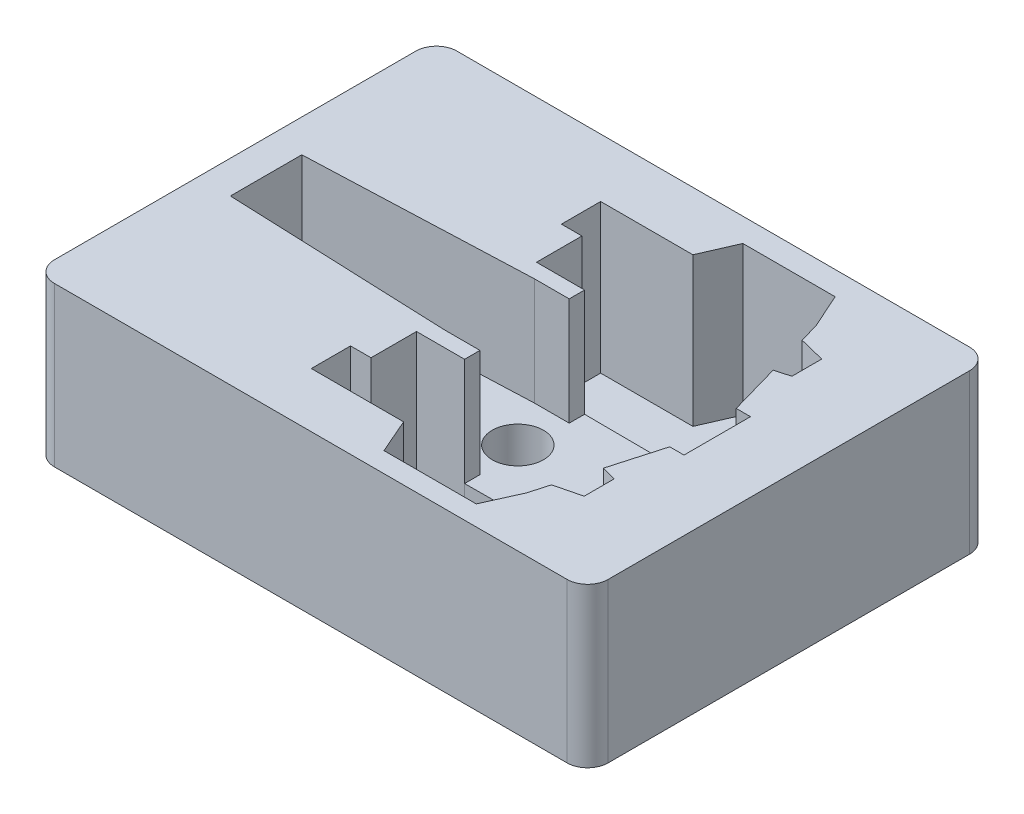
from build123d import *

# Parameters (mm, degrees)
SKETCH1_W                = 54
SKETCH1_H                = 39.25
BOSS_EXTRUDE1_DEPTH      = 15.5
FILLET1_R                = 2
FILLET2_R                = 2
E_WING_START             = 8.464149768
E_WING_BLANK_DEPTH       = 10.5
E_WING_START_2           = 4.464149768
E_WING_BLANK_2_OUTLINE_R = 2.5
E_WING_BLANK_2_DEPTH     = 4
BODY_MOVE_COPY5_ANGLE    = 90
CUT_EXTRUDE1_DEPTH       = 13.5
CUT_EXTRUDE2_DEPTH       = 3


with BuildPart() as part:
    # Sketch1 → Boss-Extrude1 (new body)
    with BuildSketch(Plane(origin=(0, 0, 0), x_dir=(1, 0, 0), z_dir=(0, 1, 0))):
        with Locations((27, 19.625)):
            Rectangle(SKETCH1_W, SKETCH1_H)
    extrude(amount=BOSS_EXTRUDE1_DEPTH)

    # Fillet1
    fillet1_edges = [part.edges().sort_by_distance(p)[0] for p in [
        (0, 7.75, 0),
    ]]
    fillet(fillet1_edges, radius=FILLET1_R)

    # Fillet2
    fillet2_edges = [part.edges().sort_by_distance(p)[0] for p in [
        (0, 7.75, -39.25),
        (54, 7.75, -39.25),
        (54, 7.75, 0),
    ]]
    fillet(fillet2_edges, radius=FILLET2_R)


with BuildPart() as body_2:
    # E-Wing Blank: read off the stored shape, not the designer's step
    # E-Wing Blank outline → E-Wing Blank (new body)
    with BuildSketch(Plane(origin=(0, 0, 0), x_dir=(1, 0, 0), z_dir=(0, 1, 0)).offset(E_WING_START)):
        Polygon((76.333039674, 32.997673143), (76.333039674, 31.604556958), (82.819483769, 31.604556958), (82.819483769, 32.997673143), (87.846693693, 34.426348928), (88.252707074, 32.997673143), (91.160450403, 32.997673143), (91.794809137, 35.548358356), (93.685930379, 36.085793467), (97.076261721, 37.607956728), (97.076261721, 46.607956728), (93.685930379, 48.085793467), (93.685930379, 57.085793467), (89.860941172, 57.085793467), (89.860941172, 55.085793467), (85.427430955, 55.085793467), (85.427430955, 50.394400823), (83.927430955, 50.394400823), (83.927430955, 53.784732166), (83.058115227, 75.604556958), (76.094408216, 75.604556958), (75.225092487, 53.784732166), (75.225092487, 50.394400823), (73.725092487, 50.394400823), (73.725092487, 55.085793467), (69.29158227, 55.085793467), (69.29158227, 57.085793467), (65.466593064, 57.085793467), (65.466593064, 48.085793467), (62.076261721, 46.607956728), (62.076261721, 37.607956728), (65.466593064, 36.085793467), (67.357714306, 35.548358356), (67.99207304, 32.997673143), (70.899816369, 32.997673143), (71.30582975, 34.426348928), align=None)
    extrude(amount=E_WING_BLANK_DEPTH)

    # E-Wing Blank 2 outline → E-Wing Blank 2 (add)
    with BuildSketch(Plane(origin=(0, 0, 0), x_dir=(1, 0, 0), z_dir=(0, 1, 0)).offset(E_WING_START_2)):
        Polygon((71.30582975, 34.426348928), (73.819434712, 33.712011036), (73.725092487, 50.394400823), (73.725092487, 55.085793467), (69.29158227, 55.085793467), (69.29158227, 57.085793467), (65.466593064, 57.085793467), (65.466593064, 48.085793467), (62.076261721, 46.607956728), (62.076261721, 37.607956728), (65.466593064, 36.085793467), (67.357714306, 35.548358356), (67.99207304, 32.997673143), (70.899816369, 32.997673143), align=None)
        Polygon((85.427430955, 50.394400823), (85.333088731, 33.712011036), (87.846693693, 34.426348928), (88.252707074, 32.997673143), (91.160450403, 32.997673143), (91.794809137, 35.548358356), (93.685930379, 36.085793467), (97.076261721, 37.607956728), (97.076261721, 46.607956728), (93.685930379, 48.085793467), (93.685930379, 57.085793467), (89.860941172, 57.085793467), (89.860941172, 55.085793467), (85.427430955, 55.085793467), align=None)
        with Locations((79.576261721, 51.054553675)):
            Circle(E_WING_BLANK_2_OUTLINE_R)
    extrude(amount=E_WING_BLANK_2_DEPTH)


with BuildPart() as body_2_1:
    # Body-Move/Copy3: moved
    add(body_2.part.moved(Location((0, -2.941364734, 30.286723837))))


with BuildPart() as body_2_2:
    # Body-Move/Copy4: moved
    add(body_2_1.part.moved(Location((-54.380009777, 0, 0))))


with BuildPart() as body_2_3:
    # Body-Move/Copy5: moved
    add(body_2_2.part.rotate(Axis((25.196251944, 0, -23.317833121), (0, 1, 0)), BODY_MOVE_COPY5_ANGLE))


with BuildPart() as body_2_4:
    # Body-Move/Copy6: moved
    add(body_2_3.part.moved(Location((0, 0, 3.871475448))))


with BuildPart() as body_2_5:
    # Body-Move/Copy8: moved
    add(body_2_4.part.moved(Location((0, -0.52, 0))))


with BuildPart() as part_1:
    add(part.part)

    # Intersect1: read off the stored shape, not the designer's step
    # Intersect1: cut body 2
    add(body_2_5.part, mode=Mode.SUBTRACT)

    # Sketch3 → Cut-Extrude1 (cut)
    with BuildSketch(Plane(origin=(0, 0, 0), x_dir=(-1, 0, 0), z_dir=(0, -1, 0))):
        Polygon((-2, 2), (-2, 14.010576961), (-22.715015436, 13.185277541), (-22.715015436, 11.161678222), (-20.715015436, 11.161678222), (-20.715015436, 3.336689015), (-29.405061858, 3.336689015), (-29.944686746, 2), align=None)
        Polygon((-2, 24.882138385), (-22.715015436, 25.707437805), (-22.715015436, 27.731037124), (-20.715015436, 27.731037124), (-20.715015436, 35.556026331), (-29.477301308, 35.556026331), (-30.143460637, 37.25), (-2, 37.25), align=None)
        Polygon((-43.248853496, 37.25), (-44.797063028, 33.545989344), (-47.572936951, 32.454370068), (-47.80313576, 26.676379962), (-46.622265015, 26.276395033), (-47.270268456, 24.671244676), (-48.650700904, 24.671244676), (-48.650700904, 20.614103613), (-52, 20.614103613), (-52, 37.25), align=None)
        Polygon((-48.650700904, 14.203135625), (-47.31395374, 14.203135625), (-47.2997118, 14.169991759), (-46.845009369, 12.553018905), (-47.80313576, 12.280730301), (-47.80313576, 6.298647203), (-44.698842535, 5.001108722), (-43.40926424, 2), (-52, 2), (-52, 18.620885492), (-48.650700904, 18.620885492), align=None)
    extrude(amount=-CUT_EXTRUDE1_DEPTH, mode=Mode.SUBTRACT)

    # Sketch4 → Cut-Extrude2 (cut)
    with BuildSketch(Plane.XZ):
        with BuildLine():
            Line((2, -14.010576961), (2, -24.882138385))
            Line((2, -24.882138385), (22.715015436, -25.707437805))
            Line((22.715015436, -25.707437805), (22.715015436, -23.250355795))
            Line((22.715015436, -23.250355795), (25.342175719, -23.250355795))
            ThreePointArc((25.342175719, -23.250355795), (23.246255228, -19.446357673), (25.342175719, -15.642359551))
            Line((25.342175719, -15.642359551), (22.715015436, -15.642359551))
            Line((22.715015436, -15.642359551), (22.715015436, -13.185277541))
            Line((22.715015436, -13.185277541), (2, -14.010576961))
        make_face()
        with BuildLine():
            Line((48.650700904, -23.250355795), (48.650700904, -20.614103613))
            Line((48.650700904, -20.614103613), (48.650700904, -18.620885492))
            Line((48.650700904, -18.620885492), (48.650700904, -15.642359551))
            Line((48.650700904, -15.642359551), (30.150334738, -15.642359551))
            ThreePointArc((30.150334738, -15.642359551), (32.246255228, -19.446357673), (30.150334738, -23.250355795))
            Line((30.150334738, -23.250355795), (48.650700904, -23.250355795))
        make_face()
    extrude(amount=-CUT_EXTRUDE2_DEPTH, mode=Mode.SUBTRACT)


solid = part_1.part
